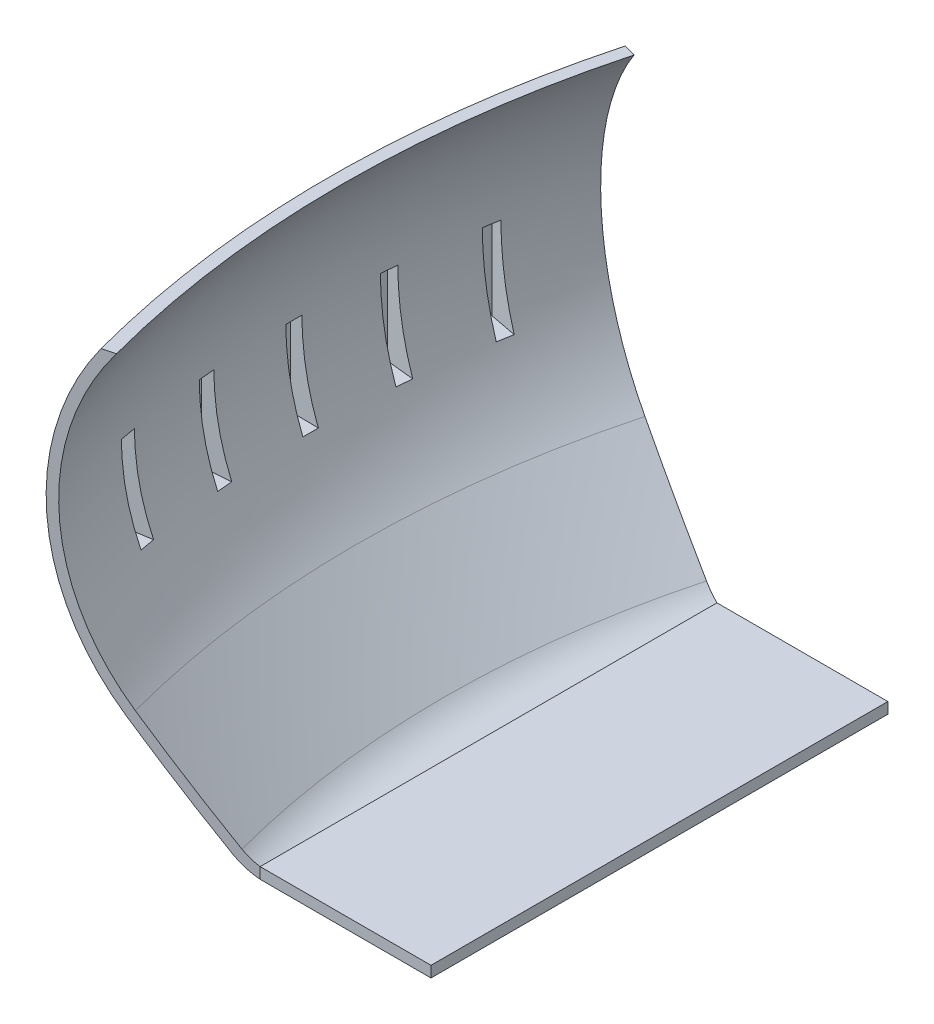
from build123d import *

# Parameters (mm, degrees)
REVOLVE1_ANGLE                  = 15
REVOLVE1_OTHER_WAY_ANGLE        = 15
REVOLVE2_START                  = 16.222144695
REVOLVE2_DEPTH                  = 16.090427574
CIRPATTERN1_COUNT               = 3
CIRPATTERN1_ANGLE               = 10
CIRPATTERN1_THE_OTHER_WAY_COUNT = 3
CIRPATTERN1_THE_OTHER_WAY_ANGLE = 10
SHELL3_START                    = 8.985762726
SHELL3_2_DEPTH                  = 42.380509533
SHELL3_START_2                  = 17.722144695
SHELL3_3_DEPTH                  = 13.090427574
CUT_EXTRUDE1_DEPTH              = 10
CUT_EXTRUDE1_DEPTH_BACK         = 10
SKETCH16_W                      = 66.82921031
SKETCH16_H                      = 1.611267236
BOSS_EXTRUDE1_DEPTH             = 25


with BuildPart() as part:
    # Sketch1 → Revolve1 (revolve)
    with BuildSketch(Plane.XY):
        with BuildLine():
            Line((-111.783895357, 7.485762726), (-118.250728673, -4.885300025))
            ThreePointArc((-118.250728673, -4.885300025), (-124.705004152, -9.547595462), (-132.307869355, -7.183042355))
            ThreePointArc((-132.307869355, -7.183042355), (-138.813052314, -0.732302942), (-145.106903203, 5.924789912))
            ThreePointArc((-145.106903203, 5.924789912), (-154.580954265, 28.121202409), (-148.092110072, 51.366272259))
            Line((-148.092110072, 51.366272259), (-106.671839554, 51.366272259))
            Line((-106.671839554, 51.366272259), (-106.671839554, 7.485762726))
            Line((-106.671839554, 7.485762726), (-111.783895357, 7.485762726))
        make_face()
    revolve(axis=Axis((0, 75.962527062, 0), (0, -1, 0)), revolution_arc=REVOLVE1_ANGLE)

    # Sketch1 → Revolve1 other way (revolve)
    with BuildSketch(Plane.XY):
        with BuildLine():
            Line((-111.783895357, 7.485762726), (-118.250728673, -4.885300025))
            ThreePointArc((-118.250728673, -4.885300025), (-124.705004152, -9.547595462), (-132.307869355, -7.183042355))
            ThreePointArc((-132.307869355, -7.183042355), (-138.813052314, -0.732302942), (-145.106903203, 5.924789912))
            ThreePointArc((-145.106903203, 5.924789912), (-154.580954265, 28.121202409), (-148.092110072, 51.366272259))
            Line((-148.092110072, 51.366272259), (-106.671839554, 51.366272259))
            Line((-106.671839554, 51.366272259), (-106.671839554, 7.485762726))
            Line((-106.671839554, 7.485762726), (-111.783895357, 7.485762726))
        make_face()
    revolve(axis=Axis((0, 75.962527062, 0), (0, 1, 0)), revolution_arc=REVOLVE1_OTHER_WAY_ANGLE)

    # Revolve2: read off the stored shape, not the designer's step
    # Revolve2 outline → Revolve2 (add)
    with BuildSketch(Plane(origin=(0, 0, 0), x_dir=(1, 0, 0), z_dir=(0, 1, 0)).offset(REVOLVE2_START)):
        with BuildLine():
            ThreePointArc((-156.32174005, 2.728606122), (-156.345552235, 0), (-156.32174005, -2.728606122))
            Line((-156.32174005, -2.728606122), (-151.716418742, -2.64821994))
            Line((-151.716418742, -2.64821994), (-150, -2.61825974))
            Line((-150, -2.61825974), (-150, 2.61825974))
            Line((-150, 2.61825974), (-151.716418742, 2.64821994))
            Line((-151.716418742, 2.64821994), (-156.32174005, 2.728606122))
        make_face()
    revolve2 = extrude(amount=REVOLVE2_DEPTH)

    # CirPattern1: Revolve2 ×3 about axis
    cirpattern1_axis = Axis((0, 0, 0), (0, 1, 0))
    for i in range(1, CIRPATTERN1_COUNT):
        add(revolve2.rotate(cirpattern1_axis, i * CIRPATTERN1_ANGLE / (CIRPATTERN1_COUNT - 1)))

    # CirPattern1 the other way: Revolve2 ×3 about axis
    cirpattern1_the_other_way_axis = Axis((0, 0, 0), (0, -1, 0))
    for i in range(1, CIRPATTERN1_THE_OTHER_WAY_COUNT):
        add(revolve2.rotate(cirpattern1_the_other_way_axis, i * CIRPATTERN1_THE_OTHER_WAY_ANGLE / (CIRPATTERN1_THE_OTHER_WAY_COUNT - 1)))

    # Shell3: read off the stored shape, not the designer's step
    # Shell3 outline → Shell3 (revolve, cut)
    with BuildSketch(Plane.XY):
        with BuildLine():
            ThreePointArc((131.268982929, -6.101046516), (137.739825777, 0.315640187), (144.000452154, 6.937591016))
            ThreePointArc((144.000452154, 6.937591016), (153.114903986, 28.748570347), (146.242378119, 51.366272259))
            Line((146.242378119, 51.366272259), (112.692366824, 51.366272259))
            Line((112.692366824, 51.366272259), (112.692366824, 8.985762726))
            Line((112.692366824, 8.985762726), (119.5800606, -4.190406776))
            ThreePointArc((119.5800606, -4.190406776), (124.946978842, -8.067241366), (131.268982929, -6.101046516))
        make_face()
    revolve(axis=Axis((0, 0, 0), (0, 1, 0)), mode=Mode.SUBTRACT)

    # Shell3 2 outline → Shell3 2 (cut)
    with BuildSketch(Plane(origin=(0, 0, 0), x_dir=(1, 0, 0), z_dir=(0, 1, 0)).offset(SHELL3_START)):
        with BuildLine():
            Line((-103.037084763, 27.608703653), (-108.852467541, 29.166930772))
            ThreePointArc((-108.852467541, 29.166930772), (-112.692366824, 0), (-108.852467541, -29.166930772))
            Line((-108.852467541, -29.166930772), (-103.037084763, -27.608703653))
            ThreePointArc((-103.037084763, -27.608703653), (-106.671839554, 0), (-103.037084763, 27.608703653))
        make_face()
    extrude(amount=SHELL3_2_DEPTH, mode=Mode.SUBTRACT)

    # Shell3 3 outline → Shell3 3 (cut)
    with BuildSketch(Plane(origin=(0, 0, 0), x_dir=(1, 0, 0), z_dir=(0, 1, 0)).offset(SHELL3_START_2)):
        with BuildLine():
            ThreePointArc((-154.840882749, 1.20252917), (-154.845552235, 0), (-154.840882749, -1.20252917))
            Line((-154.840882749, -1.20252917), (-150.729272176, -1.13076074))
            Line((-150.729272176, -1.13076074), (-112.691399989, -0.466807206))
            ThreePointArc((-112.691399989, -0.466807206), (-112.692366824, 0), (-112.691399989, 0.466807206))
            Line((-112.691399989, 0.466807206), (-150.729272176, 1.13076074))
            Line((-150.729272176, 1.13076074), (-154.840882749, 1.20252917))
        make_face()
        with BuildLine():
            ThreePointArc((-112.22189026, -10.286733541), (-112.263538345, -9.821786937), (-112.303260118, -9.356671802))
            Line((-112.303260118, -9.356671802), (-150.254254081, -12.010463816))
            Line((-150.254254081, -12.010463816), (-154.356473766, -12.29731896))
            ThreePointArc((-154.356473766, -12.29731896), (-154.25631816, -13.495679116), (-154.14685912, -14.693225327))
            Line((-154.14685912, -14.693225327), (-150.057149497, -14.263379525))
            Line((-150.057149497, -14.263379525), (-112.22189026, -10.286733541))
        make_face()
        with BuildLine():
            Line((-150.254254081, 12.010463816), (-112.303260118, 9.356671802))
            ThreePointArc((-112.303260118, 9.356671802), (-112.263538345, 9.821786937), (-112.22189026, 10.286733541))
            Line((-112.22189026, 10.286733541), (-150.057149497, 14.263379525))
            Line((-150.057149497, 14.263379525), (-154.14685912, 14.693225327))
            ThreePointArc((-154.14685912, 14.693225327), (-154.25631816, 13.495679116), (-154.356473766, 12.29731896))
            Line((-154.356473766, 12.29731896), (-150.254254081, 12.010463816))
        make_face()
        with BuildLine():
            ThreePointArc((-110.898304185, -20.028371609), (-110.980316554, -19.568824134), (-111.060424629, -19.108940881))
            Line((-111.060424629, -19.108940881), (-148.635710387, -25.06028149))
            Line((-148.635710387, -25.06028149), (-152.697318814, -25.703577068))
            ThreePointArc((-152.697318814, -25.703577068), (-152.493100361, -26.888647965), (-152.279684816, -28.072097167))
            Line((-152.279684816, -28.072097167), (-110.898304185, -20.028371609))
        make_face()
        with BuildLine():
            Line((-148.635710387, 25.06028149), (-111.060424629, 19.108940881))
            ThreePointArc((-111.060424629, 19.108940881), (-110.980316554, 19.568824134), (-110.898304185, 20.028371609))
            Line((-110.898304185, 20.028371609), (-152.279684816, 28.072097167))
            ThreePointArc((-152.279684816, 28.072097167), (-152.493100361, 26.888647965), (-152.697318814, 25.703577068))
            Line((-152.697318814, 25.703577068), (-148.635710387, 25.06028149))
        make_face()
    extrude(amount=SHELL3_3_DEPTH, mode=Mode.SUBTRACT)

    # Sketch14 → Cut-Extrude1 (cut, two sides: drawn at the far end of the back side and taken through both)
    with BuildSketch(Plane(origin=(0, 0, 0), x_dir=(1, 0, 0), z_dir=(0, 1, 0)).offset(-CUT_EXTRUDE1_DEPTH_BACK)):
        Polygon((-124.705004152, 0), (-124.705004152, 38.354721234), (-90.909809482, 38.354721234), (-90.909809482, -40.595667637), (-124.705004152, -40.595667637), align=None)
    extrude(amount=CUT_EXTRUDE1_DEPTH + CUT_EXTRUDE1_DEPTH_BACK, mode=Mode.SUBTRACT)

    # Sketch16 → Boss-Extrude1 (add)
    with BuildSketch(Plane(origin=(-124.705004152, 0, 0), x_dir=(0, 0, -1), z_dir=(1, 0, 0))):
        with Locations((0, -8.351154511)):
            Rectangle(SKETCH16_W, SKETCH16_H)
    extrude(amount=BOSS_EXTRUDE1_DEPTH)


solid = part.part
